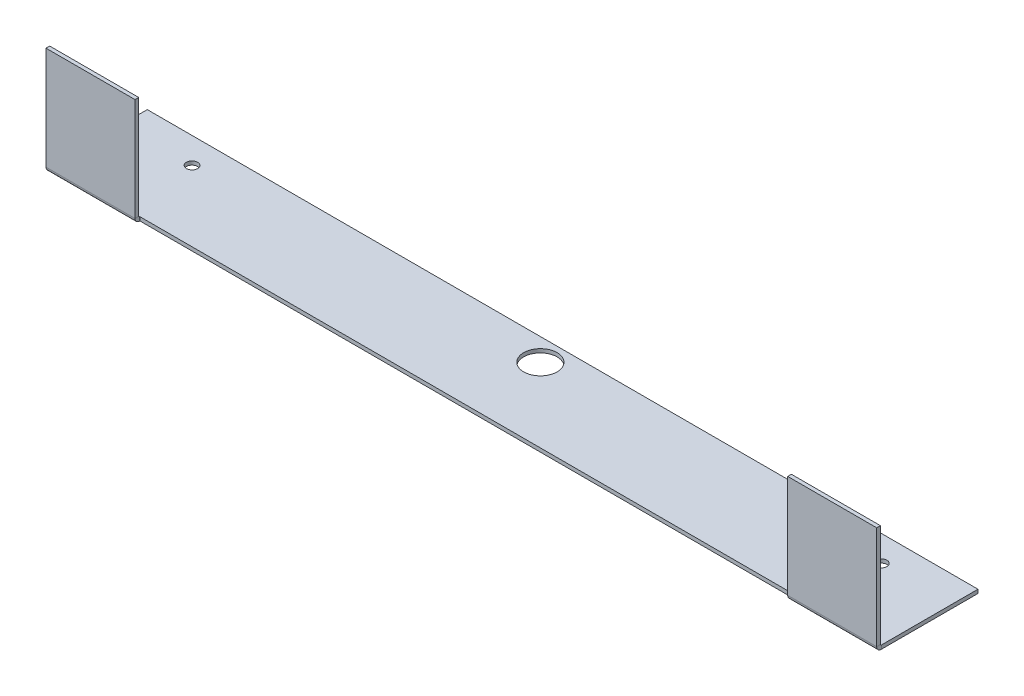
from build123d import *

# Parameters (mm, degrees)
SKETCH18_W                   = 711.2
SKETCH18_H                   = 3.175
BASE_FLANGE1_DEPTH           = 174.625
SKETCH23_W                   = 215.9
SKETCH23_H                   = 88.9
CUT_EXTRUDE1_DEPTH           = 630.633777431
SKETCH24_W                   = 127
SKETCH24_H                   = 34.925
CUT_EXTRUDE2_DEPTH           = 630.633777431
SKETCH25_W                   = 215.9
SKETCH25_H                   = 88.9
CUT_EXTRUDE3_DEPTH           = 630.633777431
SKETCH32_W                   = 558.8
SKETCH32_H                   = 92.075
CUT_EXTRUDE6_DEPTH           = 630.633777431
SKETCHED_START               = -106.274614162
SKETCHED_BEND1_OUTLINE_W     = 3.175
SKETCHED_BEND1_OUTLINE_H     = 88.9
SKETCHED_BEND1_OUTLINE_H_2   = 82.55
SKETCHED_BEND1_DEPTH         = 635
SKETCHED_START_2             = 528.725385838
SKETCHED_BEND1_2_DEPTH       = 76.2
SKETCHED_BEND1_3_OUTLINE_W   = 82.55
SKETCHED_BEND1_3_OUTLINE_H   = 3.175
SKETCHED_BEND1_3_DEPTH       = 711.2
SKETCHED_BEND1_4_OUTLINE_W   = 0.997512257
SKETCHED_BEND1_4_OUTLINE_H   = 3.175
SKETCHED_BEND1_4_OUTLINE_W_2 = 87.902487743
SKETCHED_BEND1_4_DEPTH       = 76.2
SKETCHED_BEND1_5_DEPTH       = 76.2
SKETCHED_BEND2_DEPTH         = 711.2
SKETCHED_BEND2_2_OUTLINE_W   = 3.175
SKETCHED_BEND2_2_OUTLINE_H   = 82.55
SKETCHED_BEND2_2_DEPTH       = 711.2
SKETCHED_BEND2_3_DEPTH       = 76.2
SKETCHED_BEND2_4_DEPTH       = 76.2
SKETCH35_R                   = 14.2875
SKETCH35_R_2                 = 4.7625
CUT_EXTRUDE7_DEPTH           = 619.781329454


# Read off the part's stored shape, not the designer's step: Sketched Bend1, Sketched Bend2
# Sheet-metal steps are written as plain solids
with BuildPart() as part:
    # Sketch18 → Base-Flange1 (new body)
    with BuildSketch(Plane.XY):
        with Locations((249.325385838, -1.5875)):
            Rectangle(SKETCH18_W, SKETCH18_H)
    extrude(amount=BASE_FLANGE1_DEPTH)

    # Sketch23 → Cut-Extrude1 (cut, through all)
    with BuildSketch(Plane(origin=(0, 0, 0), x_dir=(1, 0, 0), z_dir=(0, 1, 0))):
        with Locations((77.875385838, -44.45)):
            Rectangle(SKETCH23_W, SKETCH23_H)
    extrude(amount=-CUT_EXTRUDE1_DEPTH, mode=Mode.SUBTRACT)

    # Sketch24 → Cut-Extrude2 (cut, through all)
    with BuildSketch(Plane(origin=(0, 0, 0), x_dir=(1, 0, 0), z_dir=(0, 1, 0))):
        with Locations((249.325385838, -17.4625)):
            Rectangle(SKETCH24_W, SKETCH24_H)
    extrude(amount=-CUT_EXTRUDE2_DEPTH, mode=Mode.SUBTRACT)

    # Sketch25 → Cut-Extrude3 (cut, through all)
    with BuildSketch(Plane(origin=(0, 0, 0), x_dir=(1, 0, 0), z_dir=(0, 1, 0))):
        with Locations((420.775385838, -44.45)):
            Rectangle(SKETCH25_W, SKETCH25_H)
    extrude(amount=-CUT_EXTRUDE3_DEPTH, mode=Mode.SUBTRACT)

    # Sketch32 → Cut-Extrude6 (cut, through all)
    with BuildSketch(Plane.XZ.offset(3.175)):
        with Locations((249.325385838, 46.0375)):
            Rectangle(SKETCH32_W, SKETCH32_H)
    extrude(amount=-CUT_EXTRUDE6_DEPTH, mode=Mode.SUBTRACT)

    # Sketched Bend1 outline → Sketched Bend1 (cut)
    with BuildSketch(Plane.YZ.offset(SKETCHED_START)):
        with Locations((-1.5875, 44.45)):
            Rectangle(SKETCHED_BEND1_OUTLINE_W, SKETCHED_BEND1_OUTLINE_H)
        with Locations((-1.5875, 133.35)):
            Rectangle(SKETCHED_BEND1_OUTLINE_W, SKETCHED_BEND1_OUTLINE_H_2)
    extrude(amount=SKETCHED_BEND1_DEPTH, mode=Mode.SUBTRACT)

    # Sketched Bend1 2 outline → Sketched Bend1 2 (cut)
    with BuildSketch(Plane.YZ.offset(SKETCHED_START_2)):
        with BuildLine():
            ThreePointArc((-3.175, 92.005018799), (-0.896479843, 90.655319942), (0, 88.1634))
            Line((0, 88.1634), (0, 174.625))
            Line((0, 174.625), (-3.175, 174.625))
            Line((-3.175, 174.625), (-3.175, 92.005018799))
        make_face()
    extrude(amount=SKETCHED_BEND1_2_DEPTH, mode=Mode.SUBTRACT)



with BuildPart() as body_2:
    # Sketched Bend1 3 outline → Sketched Bend1 3 (new body)
    with BuildSketch(Plane.YZ.offset(SKETCHED_START)):
        with Locations((-45.447512257, 90.4875)):
            Rectangle(SKETCHED_BEND1_3_OUTLINE_W, SKETCHED_BEND1_3_OUTLINE_H)
    extrude(amount=SKETCHED_BEND1_3_DEPTH)


with BuildPart() as part_1:
    add(part.part)

    add(body_2.part)  # Sketched Bend1 4 merges body 2
    # Sketched Bend1 4 outline → Sketched Bend1 4 (add)
    with BuildSketch(Plane.YZ.offset(SKETCHED_START)):
        with Locations((-3.673756128, 90.4875)):
            Rectangle(SKETCHED_BEND1_4_OUTLINE_W, SKETCHED_BEND1_4_OUTLINE_H)
        with Locations((43.951243872, 90.4875)):
            Rectangle(SKETCHED_BEND1_4_OUTLINE_W_2, SKETCHED_BEND1_4_OUTLINE_H)
    extrude(amount=SKETCHED_BEND1_4_DEPTH)

    # Sketched Bend1 5 outline → Sketched Bend1 5 (add)
    with BuildSketch(Plane.YZ.offset(SKETCHED_START_2)):
        with BuildLine():
            Line((-4.172512257, 88.9), (-3.9116, 88.9))
            ThreePointArc((-3.9116, 88.9), (-3.390745145, 88.684254855), (-3.175, 88.1634))
            Line((-3.175, 88.1634), (-3.175, 92.005018799))
            ThreePointArc((-3.175, 92.005018799), (-3.541641581, 92.057465398), (-3.9116, 92.075))
            Line((-3.9116, 92.075), (-4.172512257, 92.075))
            Line((-4.172512257, 92.075), (-4.172512257, 88.9))
        make_face()
    extrude(amount=SKETCHED_BEND1_5_DEPTH)

    # Sketched Bend2 outline → Sketched Bend2 (cut)
    with BuildSketch(Plane.YZ.offset(SKETCHED_START)):
        with BuildLine():
            ThreePointArc((-4.102531056, 88.9), (-2.752832199, 91.178520157), (-0.260912257, 92.075))
            Line((-0.260912257, 92.075), (-86.722512257, 92.075))
            Line((-86.722512257, 92.075), (-86.722512257, 88.9))
            Line((-86.722512257, 88.9), (-4.102531056, 88.9))
        make_face()
        with BuildLine():
            Line((-0.997512257, 5.352487743), (-3.175, 5.352487743))
            Line((-3.175, 5.352487743), (-3.175, 0))
            Line((-3.175, 0), (0, 0))
            Line((0, 0), (0, 88.1634))
            ThreePointArc((0, 88.1634), (-0.017534602, 88.533358419), (-0.069981201, 88.9))
            Line((-0.069981201, 88.9), (-0.260912257, 88.9))
            ThreePointArc((-0.260912257, 88.9), (-0.781767112, 88.684254855), (-0.997512257, 88.1634))
            Line((-0.997512257, 88.1634), (-0.997512257, 5.352487743))
        make_face()
    extrude(amount=SKETCHED_BEND2_DEPTH, mode=Mode.SUBTRACT)

    # Sketched Bend2 2 outline → Sketched Bend2 2 (add)
    with BuildSketch(Plane.YZ.offset(SKETCHED_START)):
        with Locations((-2.585012257, 46.627487743)):
            Rectangle(SKETCHED_BEND2_2_OUTLINE_W, SKETCHED_BEND2_2_OUTLINE_H)
    extrude(amount=SKETCHED_BEND2_2_DEPTH)

    # Sketched Bend2 3 outline → Sketched Bend2 3 (add)
    with BuildSketch(Plane.YZ.offset(SKETCHED_START_2)):
        with BuildLine():
            ThreePointArc((-4.102531056, 88.9), (-4.154977655, 88.533358419), (-4.172512257, 88.1634))
            Line((-4.172512257, 88.1634), (-4.172512257, 87.902487743))
            Line((-4.172512257, 87.902487743), (-3.175, 87.902487743))
            Line((-3.175, 87.902487743), (-3.175, 88.1634))
            ThreePointArc((-3.175, 88.1634), (-3.390745145, 88.684254855), (-3.9116, 88.9))
            Line((-3.9116, 88.9), (-4.102531056, 88.9))
        make_face()
        with BuildLine():
            ThreePointArc((-0.260912257, 92.075), (-1.201151194, 91.960315235), (-2.086256128, 91.622985858))
            ThreePointArc((-2.086256128, 91.622985858), (-0.767990693, 90.491131747), (-0.069981201, 88.9))
            Line((-0.069981201, 88.9), (87.902487743, 88.9))
            Line((87.902487743, 88.9), (87.902487743, 92.075))
            Line((87.902487743, 92.075), (-0.260912257, 92.075))
        make_face()
    extrude(amount=SKETCHED_BEND2_3_DEPTH)

    # Sketched Bend2 4 outline → Sketched Bend2 4 (add)
    with BuildSketch(Plane.YZ.offset(SKETCHED_START)):
        with BuildLine():
            ThreePointArc((-4.102531056, 88.9), (-4.154977655, 88.533358419), (-4.172512257, 88.1634))
            Line((-4.172512257, 88.1634), (-4.172512257, 87.902487743))
            Line((-4.172512257, 87.902487743), (-0.997512257, 87.902487743))
            Line((-0.997512257, 87.902487743), (-0.997512257, 88.1634))
            ThreePointArc((-0.997512257, 88.1634), (-0.781767112, 88.684254855), (-0.260912257, 88.9))
            Line((-0.260912257, 88.9), (-4.102531056, 88.9))
        make_face()
    extrude(amount=SKETCHED_BEND2_4_DEPTH)

    # Sketch35 → Cut-Extrude7 (cut, through all)
    with BuildSketch(Plane(origin=(0, -4.172512257, 0), x_dir=(-1, 0, 0), z_dir=(0, -1, 0))):
        with Locations(Location((-249.325385838, -24.402487743, 0), (0, 0, 90))):
            Circle(SKETCH35_R)
        with Locations(Location((-544.399725838, -27.577487743, 0), (0, 0, 90))):
            Circle(SKETCH35_R_2)
        with Locations(Location((45.748954162, -27.577487743, 0), (0, 0, 90))):
            Circle(SKETCH35_R_2)
    extrude(amount=-CUT_EXTRUDE7_DEPTH, mode=Mode.SUBTRACT)


solid = part_1.part
